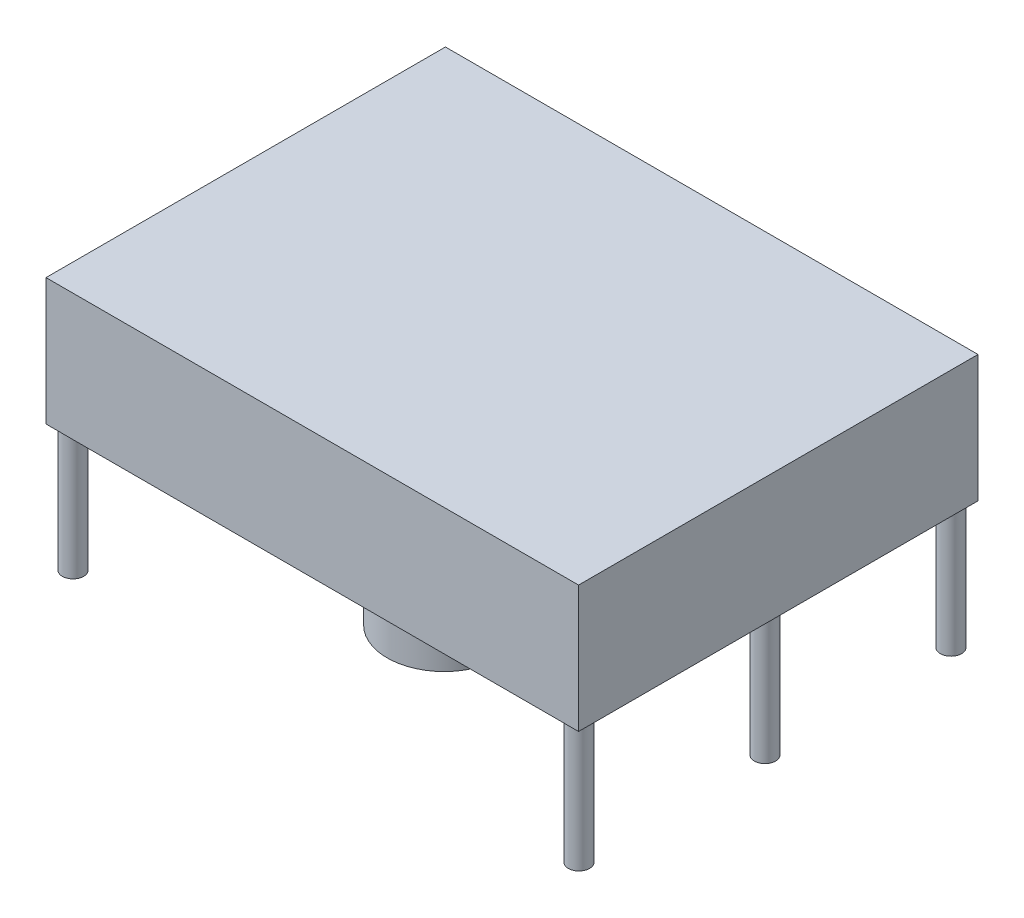
from build123d import *

# Parameters (mm, degrees)
SKETCH1_W           = 160
SKETCH1_H           = 120
BOSS_EXTRUDE1_DEPTH = 76.2
SKETCH2_OUTSIDE_W   = 204.804
SKETCH2_OUTSIDE_H   = 164.804
SKETCH2_OUTSIDE_R   = 3.2
CUT_EXTRUDE1_DEPTH  = 38.1
SKETCH3_R           = 17.125
BOSS_EXTRUDE2_DEPTH = 32.12


with BuildPart() as part:
    # Sketch1 → Boss-Extrude1 (new body)
    with BuildSketch(Plane(origin=(0, 0, 0), x_dir=(1, 0, 0), z_dir=(0, 1, 0))):
        Rectangle(SKETCH1_W, SKETCH1_H)
    extrude(amount=BOSS_EXTRUDE1_DEPTH)

    # Sketch2 outside → Cut-Extrude1 (cut)
    with BuildSketch(Plane.XZ):
        Rectangle(SKETCH2_OUTSIDE_W, SKETCH2_OUTSIDE_H)
        with Locations((-76, 55.88)):
            Circle(SKETCH2_OUTSIDE_R, mode=Mode.SUBTRACT)
        with Locations((76, 55.88)):
            Circle(SKETCH2_OUTSIDE_R, mode=Mode.SUBTRACT)
        with Locations((76, -55.88)):
            Circle(SKETCH2_OUTSIDE_R, mode=Mode.SUBTRACT)
        with Locations((-76, -55.88)):
            Circle(SKETCH2_OUTSIDE_R, mode=Mode.SUBTRACT)
        with Locations((76, 0)):
            Circle(SKETCH2_OUTSIDE_R, mode=Mode.SUBTRACT)
    extrude(amount=-CUT_EXTRUDE1_DEPTH, mode=Mode.SUBTRACT)

    # Sketch3 → Boss-Extrude2 (add)
    with BuildSketch(Plane.XZ.offset(-38.1)):
        with Locations((0, 20.375)):
            Circle(SKETCH3_R)
        with Locations((0, -20.375)):
            Circle(SKETCH3_R)
    extrude(amount=BOSS_EXTRUDE2_DEPTH)


solid = part.part
